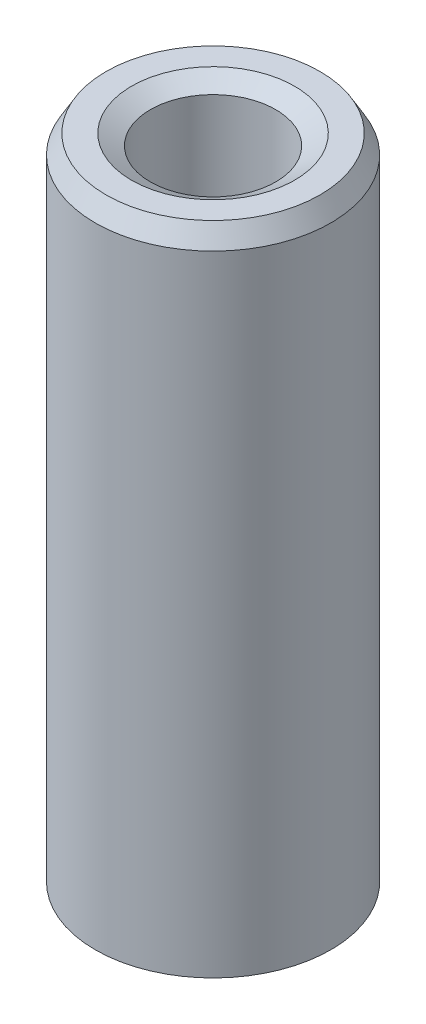
from build123d import *
from OCP.BRepFilletAPI import BRepFilletAPI_MakeChamfer

# Parameters (mm, degrees)
SKETCH1_R           = 17.5
BOSS_EXTRUDE1_DEPTH = 97.908199276
SKETCH2_R           = 9.312204786
CUT_EXTRUDE1_DEPTH  = 101.987699674
CHAMFER1_SIZE       = 2.795637379
CHAMFER1_SIZE2      = 1.614061993


with BuildPart() as part:
    # Sketch1 → Boss-Extrude1 (new body)
    with BuildSketch(Plane(origin=(0, 0, 0), x_dir=(1, 0, 0), z_dir=(0, 1, 0))):
        Circle(SKETCH1_R)
    extrude(amount=BOSS_EXTRUDE1_DEPTH)

    # Sketch2 → Cut-Extrude1 (cut, through all)
    with BuildSketch(Plane(origin=(0, 0, 0), x_dir=(1, 0, 0), z_dir=(0, 1, 0))):
        Circle(SKETCH2_R)
    extrude(amount=CUT_EXTRUDE1_DEPTH, mode=Mode.SUBTRACT)

    # Chamfer1: one chamfer whose edges measure the first distance from different faces: ONE call of the kernel's chamfer builder (chamfer() names one face for all edges)
    chamfer1_edges_1 = [part.edges().sort_by_distance(p)[0] for p in [
        (-9.312204786, 97.908199276, 0),
    ]]
    chamfer1_side_1 = [part.faces().sort_by_distance(p)[0] for p in [
        (-17.005025253, 97.908199276, 0),
    ]]
    chamfer1_edges_2 = [part.edges().sort_by_distance(p)[0] for p in [
        (-9.312204786, 0, 0),
    ]]
    chamfer1_side_2 = [part.faces().sort_by_distance(p)[0] for p in [
        (-9.312204786, 48.954099638, 0),
    ]]
    chamfer1_edges_3 = [part.edges().sort_by_distance(p)[0] for p in [
        (-17.5, 0, 0),
    ]]
    chamfer1_side_3 = [part.faces().sort_by_distance(p)[0] for p in [
        (-17.005025253, 0, 0),
    ]]
    chamfer1_edges_4 = [part.edges().sort_by_distance(p)[0] for p in [
        (-17.5, 97.908199276, 0),
    ]]
    chamfer1_side_4 = [part.faces().sort_by_distance(p)[0] for p in [
        (-17.5, 48.954099638, 0),
    ]]
    chamfer1 = BRepFilletAPI_MakeChamfer(part.part.solid().wrapped)
    for e in chamfer1_edges_1:
        chamfer1.Add(CHAMFER1_SIZE, CHAMFER1_SIZE2, e.wrapped, chamfer1_side_1[0].wrapped)  # the first distance lies on this face
    for e in chamfer1_edges_2:
        chamfer1.Add(CHAMFER1_SIZE, CHAMFER1_SIZE2, e.wrapped, chamfer1_side_2[0].wrapped)  # the first distance lies on this face
    for e in chamfer1_edges_3:
        chamfer1.Add(CHAMFER1_SIZE, CHAMFER1_SIZE2, e.wrapped, chamfer1_side_3[0].wrapped)  # the first distance lies on this face
    for e in chamfer1_edges_4:
        chamfer1.Add(CHAMFER1_SIZE, CHAMFER1_SIZE2, e.wrapped, chamfer1_side_4[0].wrapped)  # the first distance lies on this face
    add(Compound.cast(chamfer1.Shape()), mode=Mode.REPLACE)


solid = part.part
